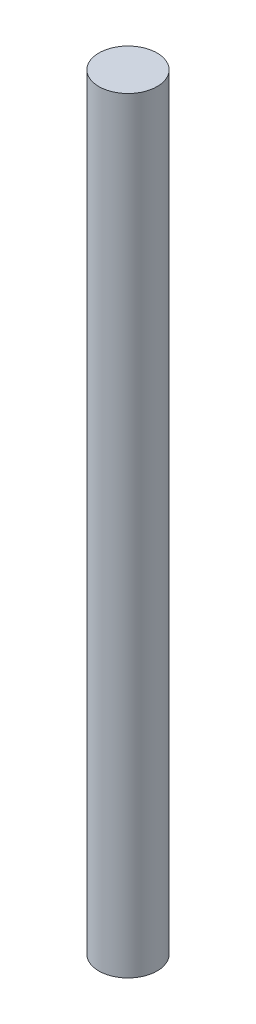
from build123d import *

# Parameters (mm, degrees)
SKETCH1_R           = 0.95
BOSS_EXTRUDE1_DEPTH = 25


with BuildPart() as part:
    # Sketch1 → Boss-Extrude1 (new body)
    with BuildSketch(Plane(origin=(0, 0, 0), x_dir=(1, 0, 0), z_dir=(0, 1, 0))):
        Circle(SKETCH1_R)
    extrude(amount=BOSS_EXTRUDE1_DEPTH)


solid = part.part
